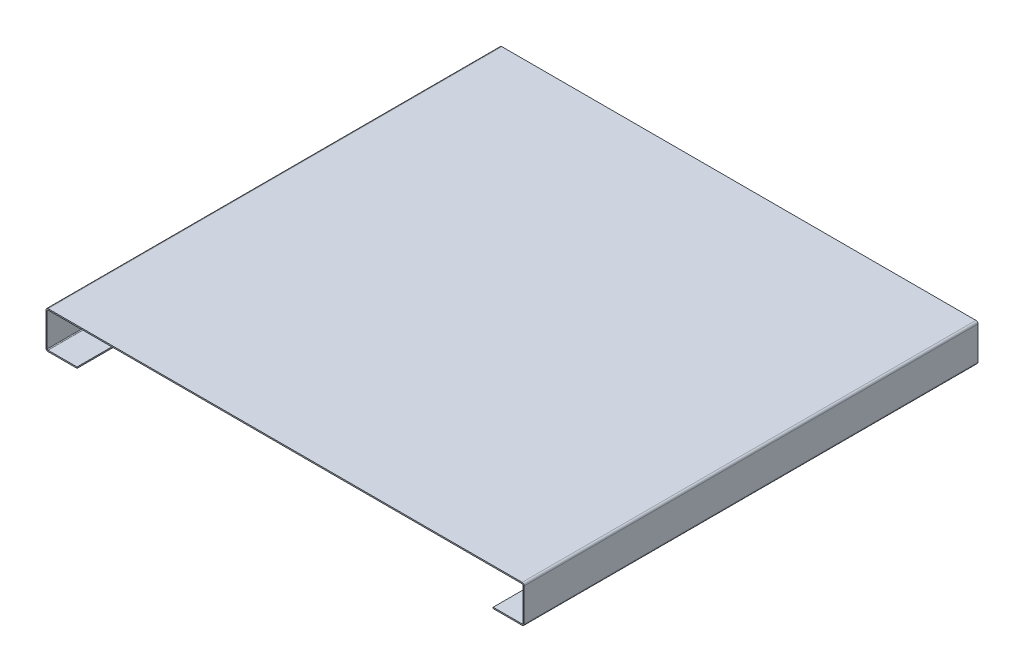
from build123d import *

# Parameters (mm, degrees)
BASE_FLANGE1_DEPTH = 1096


# Sheet-metal steps are written as plain solids
with BuildPart() as part:
    # Sketch1 → Base-Flange1 (new body)
    with BuildSketch(Plane.XY):
        with BuildLine():
            Line((75, 0), (5, 0))
            ThreePointArc((5, 0), (1.464466094, 1.464466094), (0, 5))
            Line((0, 5), (0, 85))
            ThreePointArc((0, 85), (1.464466094, 88.535533906), (5, 90))
            Line((5, 90), (1150, 90))
            ThreePointArc((1150, 90), (1153.535533906, 88.535533906), (1155, 85))
            Line((1155, 85), (1155, 5))
            ThreePointArc((1155, 5), (1153.535533906, 1.464466094), (1150, 0))
            Line((1150, 0), (1080, 0))
            Line((1080, 0), (1080, 3))
            Line((1080, 3), (1150, 3))
            ThreePointArc((1150, 3), (1151.414213562, 3.585786438), (1152, 5))
            Line((1152, 5), (1152, 85))
            ThreePointArc((1152, 85), (1151.414213562, 86.414213562), (1150, 87))
            Line((1150, 87), (5, 87))
            ThreePointArc((5, 87), (3.585786438, 86.414213562), (3, 85))
            Line((3, 85), (3, 5))
            ThreePointArc((3, 5), (3.585786438, 3.585786438), (5, 3))
            Line((5, 3), (75, 3))
            Line((75, 3), (75, 0))
        make_face()
    extrude(amount=BASE_FLANGE1_DEPTH)


solid = part.part
